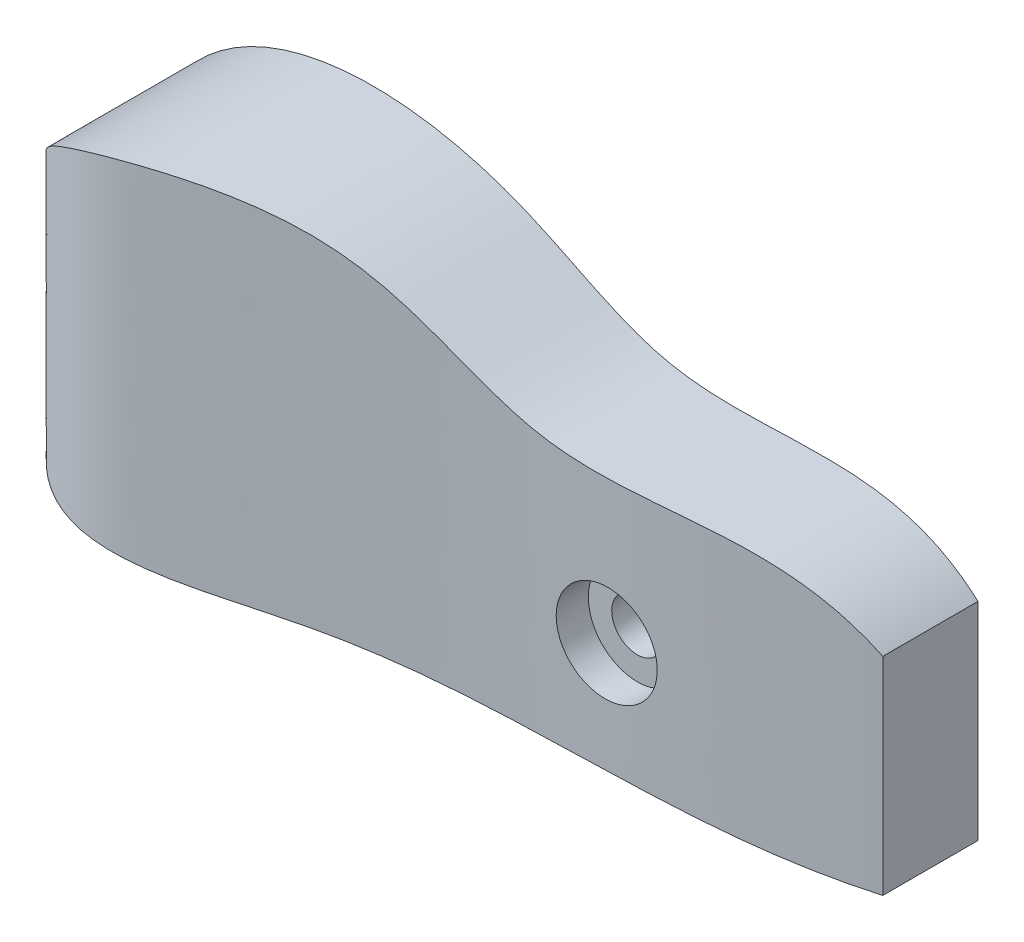
from build123d import *

# Parameters (mm, degrees)
SKETCH1_W             = 50.8
SKETCH1_H             = 12.7
BOSS_EXTRUDE1_DEPTH   = 2.54
BOSS_EXTRUDE2_DEPTH   = 2.54
BOSS_EXTRUDE3_START   = -12.6999999
BOSS_EXTRUDE3_DEPTH   = 12.6999999
BOSS_EXTRUDE3_START_2 = 8.27
BOSS_EXTRUDE3_2_DEPTH = 5.379804836
BOSS_EXTRUDE3_START_3 = 12.6999999
BOSS_EXTRUDE3_3_DEPTH = 8.826210912
BOSS_EXTRUDE4_DEPTH   = 3.301
SKETCH8_R             = 1.565
CUT_EXTRUDE2_DEPTH    = 56.73814806
SKETCH9_R             = 3
CUT_EXTRUDE3_DEPTH    = 2.54


with BuildPart() as part:
    # Sketch1 → Boss-Extrude1 (new body)
    with BuildSketch(Plane.XY.offset(5.73)):
        with Locations((25.4, 6.35)):
            Rectangle(SKETCH1_W, SKETCH1_H)
    extrude(amount=BOSS_EXTRUDE1_DEPTH)

    # Sketch2 → Boss-Extrude2 (add)
    with BuildSketch(Plane.XY.offset(8.27)):
        with BuildLine():
            Line((50.8, 12.7), (0, 12.7))
            add(Edge.make_bspline(
                [(50.8, 12.7), (45.272528283, 17.710424363), (34.142821947, 12.960220977), (18.373174323, 23.382841195), (3.436669092, 22.27035247), (0, 12.7)],
                knots=[0, 0, 0, 0, 0.358140924, 0.531313139, 1, 1, 1, 1], degree=3))
        make_face()
    extrude(amount=-BOSS_EXTRUDE2_DEPTH)

    # Boss-Extrude3: read off the stored shape, not the designer's step
    # Boss-Extrude3 outline → Boss-Extrude3 (add)
    with BuildSketch(Plane.XZ.offset(BOSS_EXTRUDE3_START)):
        with BuildLine():
            Line((0, 8.27), (50.8, 8.27))
            add(Edge.make_bspline(
                [(50.8, 8.27), (40.389049097, 11.242926836), (22.785833475, 7.806208143), (5.402288522, 16.640851878), (0, 8.27)],
                knots=[0, 0, 0, 0, 0.60422821, 1, 1, 1, 1], degree=3))
        make_face()
    extrude(amount=BOSS_EXTRUDE3_DEPTH)

    # Boss-Extrude3 2 outline → Boss-Extrude3 2 (add)
    with BuildSketch(Plane.XY.offset(BOSS_EXTRUDE3_START_2)):
        with BuildLine():
            Line((0, 12.7), (50.8, 12.7))
            add(Edge.make_bspline(
                [(50.8, 12.7), (45.272528283, 17.710424363), (34.142821947, 12.960220977), (18.373174323, 23.382841195), (3.436669092, 22.27035247), (0, 12.7)],
                knots=[0, 0, 0, 0, 0.358140924, 0.531313139, 1, 1, 1, 1], degree=3))
        make_face()
    extrude(amount=BOSS_EXTRUDE3_2_DEPTH)

    # Boss-Extrude3 3 outline → Boss-Extrude3 3 (cut)
    with BuildSketch(Plane(origin=(0, 0, 0), x_dir=(1, 0, 0), z_dir=(0, 1, 0)).offset(BOSS_EXTRUDE3_START_3)):
        with BuildLine():
            Line((50.8, -13.649804836), (50.8, -8.27))
            add(Edge.make_bspline(
                [(50.8, -8.27), (40.389049097, -11.242926836), (26.239022787, -8.48038271), (12.230935741, -13.646926994), (8.946408095, -13.649804836)],
                knots=[0, 0, 0, 0, 0.60422821, 0.803831903, 0.803831903, 0.803831903, 0.803831903], degree=3))
            Line((8.946408095, -13.649804836), (50.8, -13.649804836))
        make_face()
        with BuildLine():
            Line((0, -13.649804836), (8.924280918, -13.649804836))
            add(Edge.make_bspline(
                [(8.924280918, -13.649804836), (5.704518452, -13.646980078), (2.671577153, -12.409611674), (0, -8.27)],
                knots=[0.804280192, 0.804280192, 0.804280192, 0.804280192, 1, 1, 1, 1], degree=3))
            Line((0, -8.27), (0, -13.649804836))
        make_face()
    extrude(amount=BOSS_EXTRUDE3_3_DEPTH, mode=Mode.SUBTRACT)

    # Sketch4 → Boss-Extrude4 (add)
    with BuildSketch(Plane.XY.offset(5.73)):
        with BuildLine():
            Line((50.8, 0), (0, 0))
            Line((0, 0), (0, 12.7))
            add(Edge.make_bspline(
                [(0, 12.7), (3.436669092, 22.27035247), (18.373174323, 23.382841195), (34.142821947, 12.960220977), (45.272528283, 17.710424363), (50.8, 12.7)],
                knots=[0, 0, 0, 0, 0.468686861, 0.641859076, 1, 1, 1, 1], degree=3))
            Line((50.8, 12.7), (50.8, 0))
        make_face()
        with BuildLine():
            Line((32.889743891, 10.517784199), (21.568597255, 9.772479468))
            ThreePointArc((21.568597255, 9.772479468), (19.56744695, 8.820482655), (18.765769151, 6.754517218))
            Line((18.765769151, 6.754517218), (18.767593963, 6.53054964))
            ThreePointArc((18.767593963, 6.53054964), (19.602828658, 4.477921208), (21.619225352, 3.558657997))
            Line((21.619225352, 3.558657997), (32.951013165, 2.997921646))
            ThreePointArc((32.951013165, 2.997921646), (40.377614255, 6.818611934), (32.889743891, 10.517784199))
        make_face(mode=Mode.SUBTRACT)
    extrude(amount=-BOSS_EXTRUDE4_DEPTH)

    # Sketch8 → Cut-Extrude2 (cut, through all)
    with BuildSketch(Plane(origin=(0, 0, 5.73), x_dir=(-1, 0, 0), z_dir=(0, 0, -1))):
        with Locations((-35.701119475, 6.780509451)):
            Circle(SKETCH8_R)
    extrude(amount=-CUT_EXTRUDE2_DEPTH, mode=Mode.SUBTRACT)

    # Sketch9 → Cut-Extrude3 (cut)
    with BuildSketch(Plane(origin=(0, 0, 8.23000008), x_dir=(-1, 0, 0), z_dir=(0, 0, -1))):
        with Locations((-35.701119475, 6.780509451)):
            Circle(SKETCH9_R)
    extrude(amount=-CUT_EXTRUDE3_DEPTH, mode=Mode.SUBTRACT)


solid = part.part
